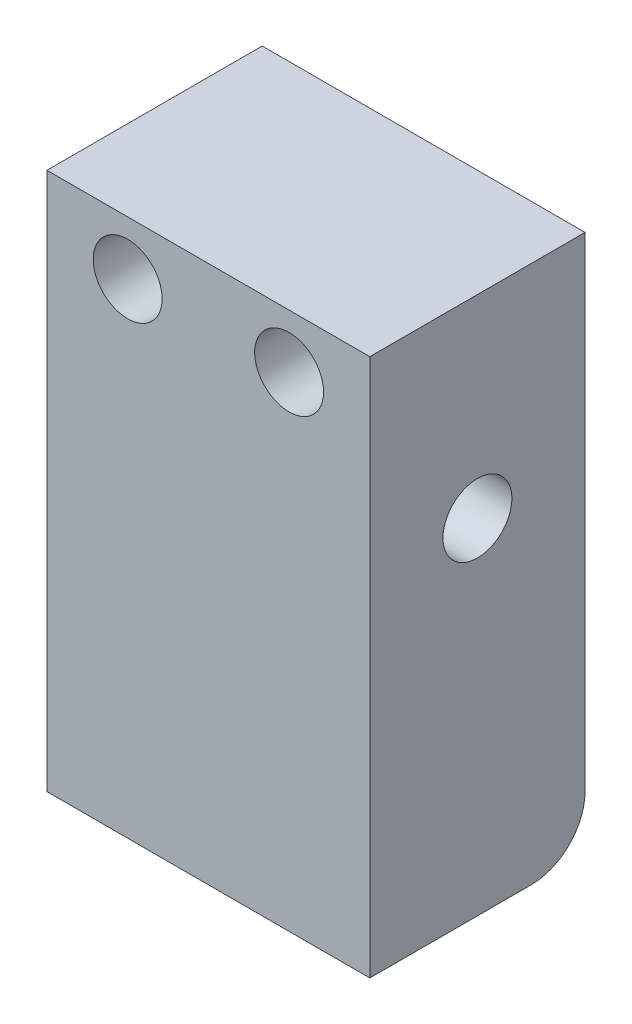
from build123d import *

# Parameters (mm, degrees)
SKETCH1_W           = 19.05
SKETCH1_H           = 31.75
SKETCH1_R           = 2.032
BOSS_EXTRUDE1_DEPTH = 12.7
SKETCH2_R           = 2.032
CUT_EXTRUDE1_DEPTH  = 40.144028919
FILLET1_R           = 3.175


with BuildPart() as part:
    # Sketch1 → Boss-Extrude1 (new body)
    with BuildSketch(Plane.XY):
        with Locations((9.525, 15.875)):
            Rectangle(SKETCH1_W, SKETCH1_H)
        with Locations((4.7625, 28.575)):
            Circle(SKETCH1_R, mode=Mode.SUBTRACT)
        with Locations((14.2875, 28.575)):
            Circle(SKETCH1_R, mode=Mode.SUBTRACT)
    extrude(amount=BOSS_EXTRUDE1_DEPTH)

    # Sketch2 → Cut-Extrude1 (cut, through all)
    with BuildSketch(Plane.ZY):
        with Locations((6.35, 20.32)):
            Circle(SKETCH2_R)
    extrude(amount=-CUT_EXTRUDE1_DEPTH, mode=Mode.SUBTRACT)

    # Fillet1
    fillet1_edges = [part.edges().sort_by_distance(p)[0] for p in [
        (9.525, 0, 0),
    ]]
    fillet(fillet1_edges, radius=FILLET1_R)


solid = part.part
